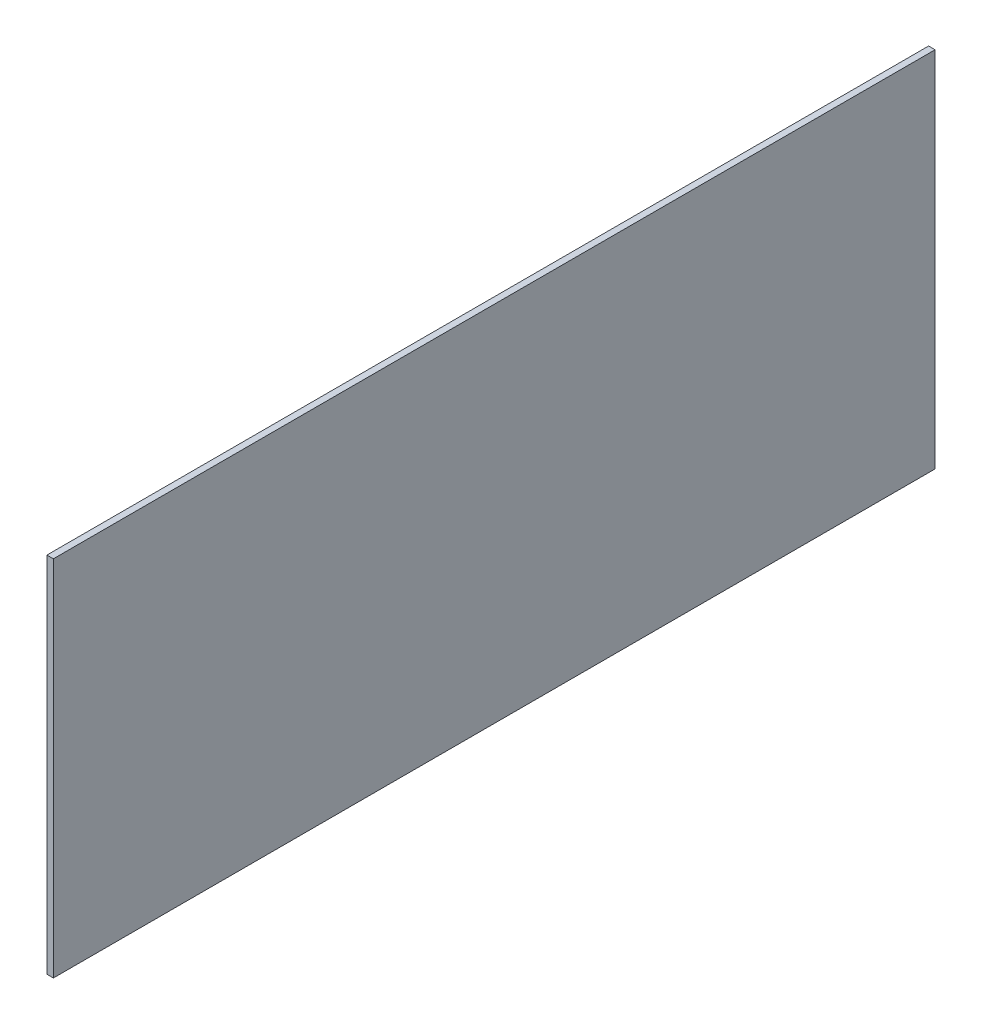
from build123d import *

# Parameters (mm, degrees)
SKIZZE1_W                       = 680
SKIZZE1_H                       = 280
AUFSATZ_LINEAR_AUSTRAGEN1_DEPTH = 5


with BuildPart() as part:
    # Skizze1 → Aufsatz-Linear austragen1 (new body)
    with BuildSketch(Plane(origin=(0, 0, 0), x_dir=(0, 0, -1), z_dir=(1, 0, 0))):
        Rectangle(SKIZZE1_W, SKIZZE1_H)
    extrude(amount=AUFSATZ_LINEAR_AUSTRAGEN1_DEPTH)


solid = part.part
